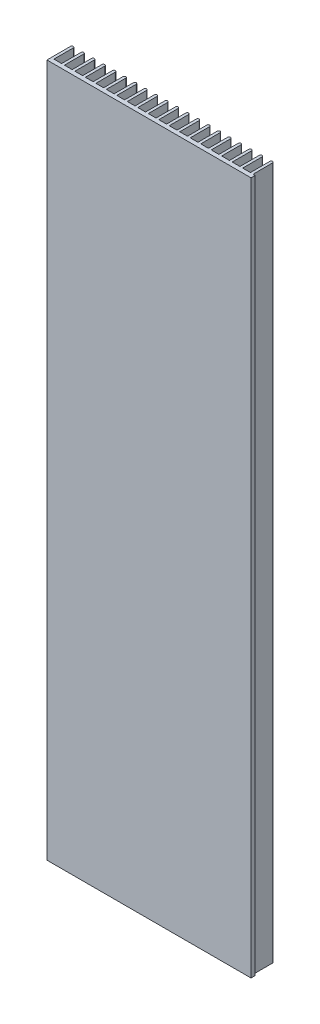
from build123d import *

# Parameters (mm, degrees)
BOSS_EXTRUDE1_DEPTH   = 330.2
BOSS_EXTRUDE2_DEPTH   = 330.2
SKETCH_PATTERN1_DEPTH = 330.2
SKETCH5_W             = 0.4826
SKETCH5_H             = 3.175
BOSS_EXTRUDE3_DEPTH   = 254
SKETCH10_OUTSIDE_W    = 282.866
SKETCH10_OUTSIDE_H    = 409.79
SKETCH10_OUTSIDE_W_2  = 91.44
SKETCH10_OUTSIDE_H_2  = 330.2
CUT_EXTRUDE3_DEPTH    = 389.485949469
SKETCH11_OUTSIDE_W    = 162.01
SKETCH11_OUTSIDE_H    = 400.77
SKETCH11_OUTSIDE_W_2  = 91.44
SKETCH11_OUTSIDE_H_2  = 310.515
CUT_EXTRUDE4_DEPTH    = 344.125324268
SKETCH12_W            = 91.44
SKETCH12_H            = 310.515
CUT_EXTRUDE5_DEPTH    = 1.27


# Read off the part's stored shape, not the designer's step: Sketch-Pattern1
with BuildPart() as part:
    # Sketch1 → Boss-Extrude1 (new body)
    with BuildSketch(Plane(origin=(0, 0, 0), x_dir=(1, 0, 0), z_dir=(0, 1, 0))):
        Polygon((1.012216501, 3.175), (1.012216501, 0), (203.805816501, 0), (203.805816501, 3.175), (2.231416501, 3.175), align=None)
    extrude(amount=BOSS_EXTRUDE1_DEPTH)

    # Sketch3 → Boss-Extrude2 (add, through all)
    with BuildSketch(Plane(origin=(0, 330.2, 0), x_dir=(1, 0, 0), z_dir=(0, 1, 0))):
        with BuildLine():
            Line((1.012216501, 3.175), (1.012216501, 11.8618))
            ThreePointArc((1.012216501, 11.8618), (1.621816501, 12.4714), (2.231416501, 11.8618))
            Line((2.231416501, 11.8618), (2.231416501, 3.175))
            Line((2.231416501, 3.175), (1.012216501, 3.175))
        make_face()
    extrude(amount=-BOSS_EXTRUDE2_DEPTH)

    # Sketch-Pattern1 outline → Sketch-Pattern1 (add)
    with BuildSketch(Plane(origin=(0, 0, 0), x_dir=(1, 0, 0), z_dir=(0, 1, 0))):
        with BuildLine():
            Line((6.930416501, 3.175), (6.930416501, 11.8618))
            ThreePointArc((6.930416501, 11.8618), (6.320816501, 12.4714), (5.711216501, 11.8618))
            Line((5.711216501, 11.8618), (5.711216501, 3.175))
            Line((5.711216501, 3.175), (6.930416501, 3.175))
        make_face()
        with BuildLine():
            Line((203.069216501, 11.8618), (203.069216501, 3.175))
            Line((203.069216501, 3.175), (204.288416501, 3.175))
            Line((204.288416501, 3.175), (204.288416501, 11.8618))
            ThreePointArc((204.288416501, 11.8618), (203.678816501, 12.4714), (203.069216501, 11.8618))
        make_face()
        with BuildLine():
            Line((198.370216501, 11.8618), (198.370216501, 3.175))
            Line((198.370216501, 3.175), (199.589416501, 3.175))
            Line((199.589416501, 3.175), (199.589416501, 11.8618))
            ThreePointArc((199.589416501, 11.8618), (198.979816501, 12.4714), (198.370216501, 11.8618))
        make_face()
        with BuildLine():
            Line((193.671216501, 11.8618), (193.671216501, 3.175))
            Line((193.671216501, 3.175), (194.890416501, 3.175))
            Line((194.890416501, 3.175), (194.890416501, 11.8618))
            ThreePointArc((194.890416501, 11.8618), (194.280816501, 12.4714), (193.671216501, 11.8618))
        make_face()
        with BuildLine():
            Line((188.972216501, 11.8618), (188.972216501, 3.175))
            Line((188.972216501, 3.175), (190.191416501, 3.175))
            Line((190.191416501, 3.175), (190.191416501, 11.8618))
            ThreePointArc((190.191416501, 11.8618), (189.581816501, 12.4714), (188.972216501, 11.8618))
        make_face()
        with BuildLine():
            Line((184.273216501, 11.8618), (184.273216501, 3.175))
            Line((184.273216501, 3.175), (185.492416501, 3.175))
            Line((185.492416501, 3.175), (185.492416501, 11.8618))
            ThreePointArc((185.492416501, 11.8618), (184.882816501, 12.4714), (184.273216501, 11.8618))
        make_face()
        with BuildLine():
            Line((179.574216501, 11.8618), (179.574216501, 3.175))
            Line((179.574216501, 3.175), (180.793416501, 3.175))
            Line((180.793416501, 3.175), (180.793416501, 11.8618))
            ThreePointArc((180.793416501, 11.8618), (180.183816501, 12.4714), (179.574216501, 11.8618))
        make_face()
        with BuildLine():
            Line((174.875216501, 11.8618), (174.875216501, 3.175))
            Line((174.875216501, 3.175), (176.094416501, 3.175))
            Line((176.094416501, 3.175), (176.094416501, 11.8618))
            ThreePointArc((176.094416501, 11.8618), (175.484816501, 12.4714), (174.875216501, 11.8618))
        make_face()
        with BuildLine():
            Line((170.176216501, 11.8618), (170.176216501, 3.175))
            Line((170.176216501, 3.175), (171.395416501, 3.175))
            Line((171.395416501, 3.175), (171.395416501, 11.8618))
            ThreePointArc((171.395416501, 11.8618), (170.785816501, 12.4714), (170.176216501, 11.8618))
        make_face()
        with BuildLine():
            Line((165.477216501, 11.8618), (165.477216501, 3.175))
            Line((165.477216501, 3.175), (166.696416501, 3.175))
            Line((166.696416501, 3.175), (166.696416501, 11.8618))
            ThreePointArc((166.696416501, 11.8618), (166.086816501, 12.4714), (165.477216501, 11.8618))
        make_face()
        with BuildLine():
            Line((160.778216501, 11.8618), (160.778216501, 3.175))
            Line((160.778216501, 3.175), (161.997416501, 3.175))
            Line((161.997416501, 3.175), (161.997416501, 11.8618))
            ThreePointArc((161.997416501, 11.8618), (161.387816501, 12.4714), (160.778216501, 11.8618))
        make_face()
        with BuildLine():
            Line((156.079216501, 11.8618), (156.079216501, 3.175))
            Line((156.079216501, 3.175), (157.298416501, 3.175))
            Line((157.298416501, 3.175), (157.298416501, 11.8618))
            ThreePointArc((157.298416501, 11.8618), (156.688816501, 12.4714), (156.079216501, 11.8618))
        make_face()
        with BuildLine():
            Line((151.380216501, 11.8618), (151.380216501, 3.175))
            Line((151.380216501, 3.175), (152.599416501, 3.175))
            Line((152.599416501, 3.175), (152.599416501, 11.8618))
            ThreePointArc((152.599416501, 11.8618), (151.989816501, 12.4714), (151.380216501, 11.8618))
        make_face()
        with BuildLine():
            Line((146.681216501, 11.8618), (146.681216501, 3.175))
            Line((146.681216501, 3.175), (147.900416501, 3.175))
            Line((147.900416501, 3.175), (147.900416501, 11.8618))
            ThreePointArc((147.900416501, 11.8618), (147.290816501, 12.4714), (146.681216501, 11.8618))
        make_face()
        with BuildLine():
            Line((141.982216501, 11.8618), (141.982216501, 3.175))
            Line((141.982216501, 3.175), (143.201416501, 3.175))
            Line((143.201416501, 3.175), (143.201416501, 11.8618))
            ThreePointArc((143.201416501, 11.8618), (142.591816501, 12.4714), (141.982216501, 11.8618))
        make_face()
        with BuildLine():
            Line((137.283216501, 11.8618), (137.283216501, 3.175))
            Line((137.283216501, 3.175), (138.502416501, 3.175))
            Line((138.502416501, 3.175), (138.502416501, 11.8618))
            ThreePointArc((138.502416501, 11.8618), (137.892816501, 12.4714), (137.283216501, 11.8618))
        make_face()
        with BuildLine():
            Line((132.584216501, 11.8618), (132.584216501, 3.175))
            Line((132.584216501, 3.175), (133.803416501, 3.175))
            Line((133.803416501, 3.175), (133.803416501, 11.8618))
            ThreePointArc((133.803416501, 11.8618), (133.193816501, 12.4714), (132.584216501, 11.8618))
        make_face()
        with BuildLine():
            Line((127.885216501, 11.8618), (127.885216501, 3.175))
            Line((127.885216501, 3.175), (129.104416501, 3.175))
            Line((129.104416501, 3.175), (129.104416501, 11.8618))
            ThreePointArc((129.104416501, 11.8618), (128.494816501, 12.4714), (127.885216501, 11.8618))
        make_face()
        with BuildLine():
            Line((123.186216501, 11.8618), (123.186216501, 3.175))
            Line((123.186216501, 3.175), (124.405416501, 3.175))
            Line((124.405416501, 3.175), (124.405416501, 11.8618))
            ThreePointArc((124.405416501, 11.8618), (123.795816501, 12.4714), (123.186216501, 11.8618))
        make_face()
        with BuildLine():
            Line((118.487216501, 11.8618), (118.487216501, 3.175))
            Line((118.487216501, 3.175), (119.706416501, 3.175))
            Line((119.706416501, 3.175), (119.706416501, 11.8618))
            ThreePointArc((119.706416501, 11.8618), (119.096816501, 12.4714), (118.487216501, 11.8618))
        make_face()
        with BuildLine():
            Line((113.788216501, 11.8618), (113.788216501, 3.175))
            Line((113.788216501, 3.175), (115.007416501, 3.175))
            Line((115.007416501, 3.175), (115.007416501, 11.8618))
            ThreePointArc((115.007416501, 11.8618), (114.397816501, 12.4714), (113.788216501, 11.8618))
        make_face()
        with BuildLine():
            Line((109.089216501, 11.8618), (109.089216501, 3.175))
            Line((109.089216501, 3.175), (110.308416501, 3.175))
            Line((110.308416501, 3.175), (110.308416501, 11.8618))
            ThreePointArc((110.308416501, 11.8618), (109.698816501, 12.4714), (109.089216501, 11.8618))
        make_face()
        with BuildLine():
            Line((104.390216501, 11.8618), (104.390216501, 3.175))
            Line((104.390216501, 3.175), (105.609416501, 3.175))
            Line((105.609416501, 3.175), (105.609416501, 11.8618))
            ThreePointArc((105.609416501, 11.8618), (104.999816501, 12.4714), (104.390216501, 11.8618))
        make_face()
        with BuildLine():
            Line((99.691216501, 11.8618), (99.691216501, 3.175))
            Line((99.691216501, 3.175), (100.910416501, 3.175))
            Line((100.910416501, 3.175), (100.910416501, 11.8618))
            ThreePointArc((100.910416501, 11.8618), (100.300816501, 12.4714), (99.691216501, 11.8618))
        make_face()
        with BuildLine():
            Line((94.992216501, 11.8618), (94.992216501, 3.175))
            Line((94.992216501, 3.175), (96.211416501, 3.175))
            Line((96.211416501, 3.175), (96.211416501, 11.8618))
            ThreePointArc((96.211416501, 11.8618), (95.601816501, 12.4714), (94.992216501, 11.8618))
        make_face()
        with BuildLine():
            Line((90.293216501, 11.8618), (90.293216501, 3.175))
            Line((90.293216501, 3.175), (91.512416501, 3.175))
            Line((91.512416501, 3.175), (91.512416501, 11.8618))
            ThreePointArc((91.512416501, 11.8618), (90.902816501, 12.4714), (90.293216501, 11.8618))
        make_face()
        with BuildLine():
            Line((85.594216501, 11.8618), (85.594216501, 3.175))
            Line((85.594216501, 3.175), (86.813416501, 3.175))
            Line((86.813416501, 3.175), (86.813416501, 11.8618))
            ThreePointArc((86.813416501, 11.8618), (86.203816501, 12.4714), (85.594216501, 11.8618))
        make_face()
        with BuildLine():
            Line((80.895216501, 11.8618), (80.895216501, 3.175))
            Line((80.895216501, 3.175), (82.114416501, 3.175))
            Line((82.114416501, 3.175), (82.114416501, 11.8618))
            ThreePointArc((82.114416501, 11.8618), (81.504816501, 12.4714), (80.895216501, 11.8618))
        make_face()
        with BuildLine():
            Line((76.196216501, 11.8618), (76.196216501, 3.175))
            Line((76.196216501, 3.175), (77.415416501, 3.175))
            Line((77.415416501, 3.175), (77.415416501, 11.8618))
            ThreePointArc((77.415416501, 11.8618), (76.805816501, 12.4714), (76.196216501, 11.8618))
        make_face()
        with BuildLine():
            Line((71.497216501, 11.8618), (71.497216501, 3.175))
            Line((71.497216501, 3.175), (72.716416501, 3.175))
            Line((72.716416501, 3.175), (72.716416501, 11.8618))
            ThreePointArc((72.716416501, 11.8618), (72.106816501, 12.4714), (71.497216501, 11.8618))
        make_face()
        with BuildLine():
            Line((66.798216501, 11.8618), (66.798216501, 3.175))
            Line((66.798216501, 3.175), (68.017416501, 3.175))
            Line((68.017416501, 3.175), (68.017416501, 11.8618))
            ThreePointArc((68.017416501, 11.8618), (67.407816501, 12.4714), (66.798216501, 11.8618))
        make_face()
        with BuildLine():
            Line((62.099216501, 11.8618), (62.099216501, 3.175))
            Line((62.099216501, 3.175), (63.318416501, 3.175))
            Line((63.318416501, 3.175), (63.318416501, 11.8618))
            ThreePointArc((63.318416501, 11.8618), (62.708816501, 12.4714), (62.099216501, 11.8618))
        make_face()
        with BuildLine():
            Line((57.400216501, 11.8618), (57.400216501, 3.175))
            Line((57.400216501, 3.175), (58.619416501, 3.175))
            Line((58.619416501, 3.175), (58.619416501, 11.8618))
            ThreePointArc((58.619416501, 11.8618), (58.009816501, 12.4714), (57.400216501, 11.8618))
        make_face()
        with BuildLine():
            Line((52.701216501, 11.8618), (52.701216501, 3.175))
            Line((52.701216501, 3.175), (53.920416501, 3.175))
            Line((53.920416501, 3.175), (53.920416501, 11.8618))
            ThreePointArc((53.920416501, 11.8618), (53.310816501, 12.4714), (52.701216501, 11.8618))
        make_face()
        with BuildLine():
            Line((48.002216501, 11.8618), (48.002216501, 3.175))
            Line((48.002216501, 3.175), (49.221416501, 3.175))
            Line((49.221416501, 3.175), (49.221416501, 11.8618))
            ThreePointArc((49.221416501, 11.8618), (48.611816501, 12.4714), (48.002216501, 11.8618))
        make_face()
        with BuildLine():
            Line((43.303216501, 11.8618), (43.303216501, 3.175))
            Line((43.303216501, 3.175), (44.522416501, 3.175))
            Line((44.522416501, 3.175), (44.522416501, 11.8618))
            ThreePointArc((44.522416501, 11.8618), (43.912816501, 12.4714), (43.303216501, 11.8618))
        make_face()
        with BuildLine():
            Line((38.604216501, 11.8618), (38.604216501, 3.175))
            Line((38.604216501, 3.175), (39.823416501, 3.175))
            Line((39.823416501, 3.175), (39.823416501, 11.8618))
            ThreePointArc((39.823416501, 11.8618), (39.213816501, 12.4714), (38.604216501, 11.8618))
        make_face()
        with BuildLine():
            Line((33.905216501, 11.8618), (33.905216501, 3.175))
            Line((33.905216501, 3.175), (35.124416501, 3.175))
            Line((35.124416501, 3.175), (35.124416501, 11.8618))
            ThreePointArc((35.124416501, 11.8618), (34.514816501, 12.4714), (33.905216501, 11.8618))
        make_face()
        with BuildLine():
            Line((29.206216501, 11.8618), (29.206216501, 3.175))
            Line((29.206216501, 3.175), (30.425416501, 3.175))
            Line((30.425416501, 3.175), (30.425416501, 11.8618))
            ThreePointArc((30.425416501, 11.8618), (29.815816501, 12.4714), (29.206216501, 11.8618))
        make_face()
        with BuildLine():
            Line((24.507216501, 11.8618), (24.507216501, 3.175))
            Line((24.507216501, 3.175), (25.726416501, 3.175))
            Line((25.726416501, 3.175), (25.726416501, 11.8618))
            ThreePointArc((25.726416501, 11.8618), (25.116816501, 12.4714), (24.507216501, 11.8618))
        make_face()
        with BuildLine():
            Line((19.808216501, 11.8618), (19.808216501, 3.175))
            Line((19.808216501, 3.175), (21.027416501, 3.175))
            Line((21.027416501, 3.175), (21.027416501, 11.8618))
            ThreePointArc((21.027416501, 11.8618), (20.417816501, 12.4714), (19.808216501, 11.8618))
        make_face()
        with BuildLine():
            Line((15.109216501, 11.8618), (15.109216501, 3.175))
            Line((15.109216501, 3.175), (16.328416501, 3.175))
            Line((16.328416501, 3.175), (16.328416501, 11.8618))
            ThreePointArc((16.328416501, 11.8618), (15.718816501, 12.4714), (15.109216501, 11.8618))
        make_face()
        with BuildLine():
            Line((10.410216501, 11.8618), (10.410216501, 3.175))
            Line((10.410216501, 3.175), (11.629416501, 3.175))
            Line((11.629416501, 3.175), (11.629416501, 11.8618))
            ThreePointArc((11.629416501, 11.8618), (11.019816501, 12.4714), (10.410216501, 11.8618))
        make_face()
    extrude(amount=SKETCH_PATTERN1_DEPTH)

    # Sketch5 → Boss-Extrude3 (add)
    with BuildSketch(Plane(origin=(0, 330.2, 0), x_dir=(1, 0, 0), z_dir=(0, 1, 0))):
        with Locations((204.047116501, 1.5875)):
            Rectangle(SKETCH5_W, SKETCH5_H)
    extrude(amount=-BOSS_EXTRUDE3_DEPTH)

    # Sketch10 outside → Cut-Extrude3 (cut, through all)
    with BuildSketch(Plane.XY):
        with Locations((102.65, 165.1)):
            Rectangle(SKETCH10_OUTSIDE_W, SKETCH10_OUTSIDE_H)
        with Locations((46.732216501, 165.1)):
            Rectangle(SKETCH10_OUTSIDE_W_2, SKETCH10_OUTSIDE_H_2, mode=Mode.SUBTRACT)
    extrude(amount=-CUT_EXTRUDE3_DEPTH, mode=Mode.SUBTRACT)

    # Sketch11 outside → Cut-Extrude4 (cut, through all)
    with BuildSketch(Plane.XY):
        with Locations((46.732, 165.1)):
            Rectangle(SKETCH11_OUTSIDE_W, SKETCH11_OUTSIDE_H)
        with Locations((46.732216501, 174.9425)):
            Rectangle(SKETCH11_OUTSIDE_W_2, SKETCH11_OUTSIDE_H_2, mode=Mode.SUBTRACT)
    extrude(amount=-CUT_EXTRUDE4_DEPTH, mode=Mode.SUBTRACT)

    # Sketch12 → Cut-Extrude5 (cut)
    with BuildSketch(Plane.XY):
        with Locations((46.732216501, 174.9425)):
            Rectangle(SKETCH12_W, SKETCH12_H)
    extrude(amount=-CUT_EXTRUDE5_DEPTH, mode=Mode.SUBTRACT)


solid = part.part
